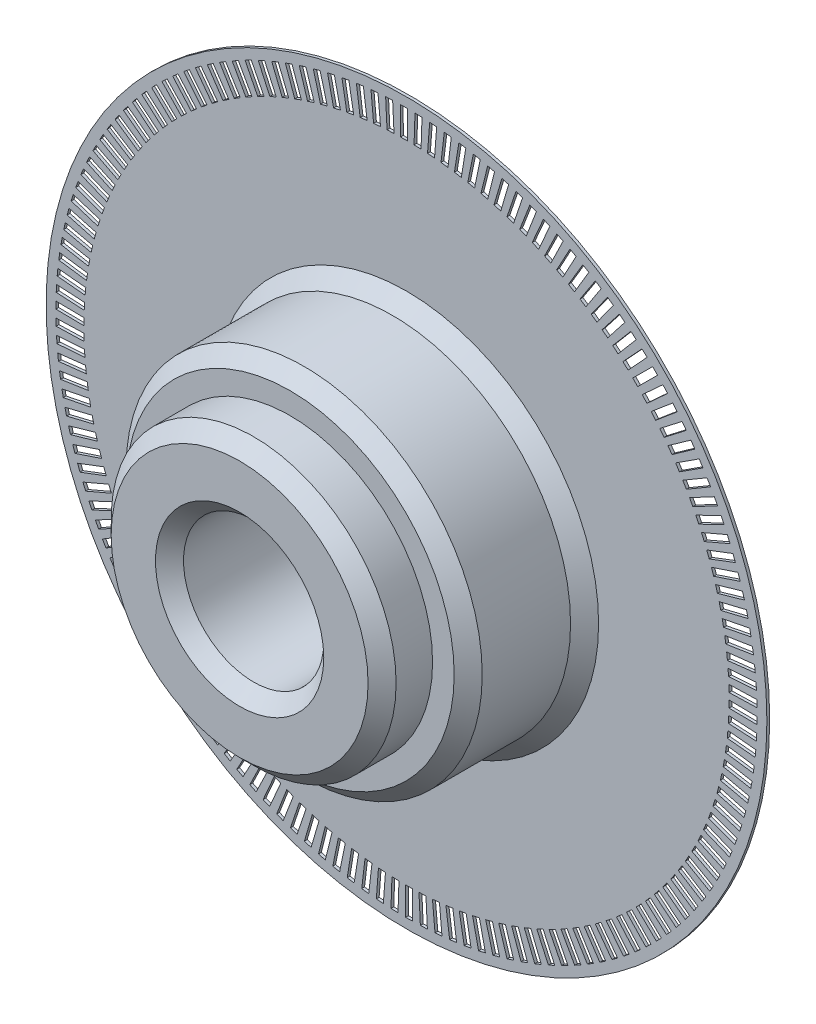
from build123d import *

# Parameters (mm, degrees)
SZKIC1_R                        = 12.85
DODANIE_WYCI_GNI_CIE1_DEPTH     = 0.1
SZKIC2_R                        = 6.35
DODANIE_WYCI_GNI_CIE2_DEPTH     = 4.15
SZKIC3_R                        = 5.08
DODANIE_WYCI_GNI_CIE3_DEPTH     = 1.8
WYTNIJ_WYCI_GNI_CIE1_DEPTH      = 20.15326343
WYTNIJ_WYCI_GNI_CIE1_DEPTH_BACK = 20.15326343
SZKIC5_R                        = 2.5
SFAZOWANIE1_SIZE                = 0.5
WYTNIJ_WYCI_GNI_CIE2_DEPTH      = 20.15326343


with BuildPart() as part:
    # Szkic1 → Dodanie-wyciągnięcie1 (new body)
    with BuildSketch(Plane.XY):
        Circle(SZKIC1_R)
    extrude(amount=DODANIE_WYCI_GNI_CIE1_DEPTH)

    # Szkic2 → Dodanie-wyciągnięcie2 (add)
    with BuildSketch(Plane.XY.offset(0.1)):
        Circle(SZKIC2_R)
    extrude(amount=DODANIE_WYCI_GNI_CIE2_DEPTH)

    # Szkic3 → Dodanie-wyciągnięcie3 (add)
    with BuildSketch(Plane.XY.offset(4.25)):
        Circle(SZKIC3_R)
    extrude(amount=DODANIE_WYCI_GNI_CIE3_DEPTH)

    # Szkic5 → Wytnij-wyciągnięcie1 (cut, two sides: drawn at the far end of the back side and taken through both)
    with BuildSketch(Plane(origin=(0, 0, 0), x_dir=(-1, 0, 0), z_dir=(0, 0, -1)).offset(-WYTNIJ_WYCI_GNI_CIE1_DEPTH_BACK)):
        Circle(SZKIC5_R)
    extrude(amount=WYTNIJ_WYCI_GNI_CIE1_DEPTH + WYTNIJ_WYCI_GNI_CIE1_DEPTH_BACK, mode=Mode.SUBTRACT)

    # Sfazowanie1
    sfazowanie1_edges = [part.edges().sort_by_distance(p)[0] for p in [
        (-5.08, 0, 6.05),
        (2.5, 0, 0),
        (2.5, 0, 6.05),
        (-6.35, 0, 0.1),
        (-6.35, 0, 4.25),
    ]]
    chamfer(sfazowanie1_edges, length=SFAZOWANIE1_SIZE)

    # Szkic7 → Wytnij-wyciągnięcie2 (cut, through all)
    with BuildSketch(Plane(origin=(0, 0, 0), x_dir=(-1, 0, 0), z_dir=(0, 0, -1))):
        Polygon((-4.431248358, -10.614251271), (-4.806721156, -11.541084685), (-4.575012803, -11.634952885), (-4.199540005, -10.70811947), align=None)
        Polygon((-3.747446792, -10.874585113), (-4.083778481, -11.816328706), (-4.319214379, -11.732245784), (-3.98288269, -10.790502191), align=None)
        Polygon((-4.871840111, -10.419379347), (-5.285795311, -11.329676602), (-5.058220997, -11.433165402), (-4.644265798, -10.522868147), align=None)
        Polygon((-5.303885002, -10.206228292), (-5.755596385, -11.098392417), (-5.532555353, -11.211320263), (-5.08084397, -10.319156138), align=None)
        Polygon((-5.726625075, -9.975172044), (-6.215300187, -10.84763788), (-5.997183728, -10.969806658), (-5.508508616, -10.097340822), align=None)
        Polygon((-6.139318702, -9.726615954), (-6.66410024, -10.5778529), (-6.451291004, -10.709048284), (-5.926509466, -9.857811339), align=None)
        Polygon((-6.541241878, -9.460996075), (-7.101209197, -10.289510772), (-6.894080523, -10.429502601), (-6.334113204, -9.600987905), align=None)
        Polygon((-6.931689494, -9.178778395), (-7.52586022, -9.983117345), (-7.324775483, -10.131660027), (-6.730604756, -9.327321076), align=None)
        Polygon((-7.30997657, -8.880458018), (-7.937308327, -9.659210139), (-7.742620297, -9.816043078), (-7.11528854, -9.037290957), align=None)
        Polygon((-7.675439463, -8.566558299), (-8.334831698, -9.318357395), (-8.146881924, -9.483205454), (-7.487489689, -8.731406358), align=None)
        Polygon((-8.027437028, -8.237629927), (-8.717732943, -8.961157086), (-8.536851153, -9.133731065), (-7.846555238, -8.410203906), align=None)
        Polygon((-8.36535174, -7.894249953), (-9.085340321, -8.588235863), (-8.911843843, -8.768233008), (-8.191855263, -8.074247098), align=None)
        Polygon((-8.688590783, -7.537020782), (-9.437008925, -8.200247956), (-9.271202131, -8.387352491), (-8.522783989, -7.724125317), align=None)
        Polygon((-8.996587085, -7.166569115), (-9.772121809, -7.797874027), (-9.61429558, -7.991757708), (-8.838760857, -7.360452796), align=None)
        Polygon((-9.288800316, -6.783544851), (-10.09009107, -7.381819978), (-9.940522288, -7.582142666), (-9.139231534, -6.983867539), align=None)
        Polygon((-9.564717835, -6.388619944), (-10.390358883, -6.952815708), (-10.249309942, -7.15922597), (-9.423668894, -6.595030206), align=None)
        Polygon((-9.823855589, -5.982487226), (-10.672398476, -6.511613836), (-10.540116824, -6.723749558), (-9.691573937, -6.194622948), align=None)
        Polygon((-10.065758962, -5.565859194), (-10.935715056, -6.058988382), (-10.812432759, -6.276477405), (-9.942476665, -5.783348217), align=None)
        Polygon((-10.290003574, -5.139466753), (-11.179846675, -5.595733402), (-11.065780012, -5.818194178), (-10.175936911, -5.361927528), align=None)
        Polygon((-10.496196023, -4.704057941), (-11.404365044, -5.122661605), (-11.299714128, -5.349703861), (-10.391545106, -4.931100196), align=None)
        Polygon((-10.683974577, -4.260396612), (-11.608876282, -4.640602919), (-11.513824705, -4.871828346), (-10.588923, -4.491622039), align=None)
        Polygon((-10.853009809, -3.809261101), (-11.793021606, -4.150403039), (-11.707736122, -4.385405988), (-10.767724325, -4.04426405), align=None)
        Polygon((-11.003005174, -3.351442851), (-11.956477963, -3.652921941), (-11.881108191, -3.891290138), (-10.927635402, -3.589811048), align=None)
        Polygon((-11.13369753, -2.887745032), (-12.098958595, -3.149032377), (-12.033636758, -3.390347643), (-11.068375694, -3.129060298), align=None)
        Polygon((-11.244857596, -2.418981126), (-12.220213542, -2.63961834), (-12.165054238, -2.883457326), (-11.189698293, -2.662820112), align=None)
        Polygon((-11.336290362, -1.945973506), (-12.320030082, -2.125573515), (-12.275130079, -2.371508445), (-11.291390359, -2.191908436), align=None)
        Polygon((-11.407835422, -1.469551987), (-12.398233103, -1.607799712), (-12.363671171, -1.855399133), (-11.37327349, -1.717151407), align=None)
        Polygon((-11.459367262, -0.990552374), (-12.45468541, -1.087205283), (-12.430522183, -1.33603482), (-11.435204035, -1.239381911), align=None)
        Polygon((-11.490795478, -0.509814996), (-12.489287967, -0.564703525), (-12.475565834, -0.814326647), (-11.477073346, -0.759438118), align=None)
        Polygon((-11.502064935, -0.028183229), (-12.501980068, -0.041211086), (-12.498723104, -0.29118987), (-11.49880797, -0.278162012), align=None)
        Polygon((-11.493155861, 0.453497981), (-12.492739449, 0.482353651), (-12.499953367, 0.232457754), (-11.500369778, 0.203602084), align=None)
        Polygon((-11.464083886, 0.934383601), (-12.461582319, 1.005072176), (-12.479254463, 0.755697568), (-11.481756029, 0.685008993), align=None)
        Polygon((-11.414900012, 1.413629995), (-12.40856334, 1.526027463), (-12.436662707, 1.277611632), (-11.442999379, 1.165214163), align=None)
        Polygon((-11.345690525, 1.890396402), (-12.333775524, 2.04430558), (-12.372252819, 1.79728433), (-11.38416782, 1.643375152), align=None)
        Polygon((-11.256576842, 2.363846411), (-12.237350075, 2.55899729), (-12.286137795, 2.313803981), (-11.305364562, 2.118653103), align=None)
        Polygon((-11.147715298, 2.83314943), (-12.119456155, 3.069199648), (-12.17846871, 2.826264434), (-11.206727852, 2.590214215), align=None)
        Polygon((-11.019296873, 3.297482142), (-11.980300592, 3.574017588), (-12.049434453, 3.333766659), (-11.088430735, 3.057231212), align=None)
        Polygon((-10.871546857, 3.75602995), (-11.820127509, 4.072565487), (-11.899261394, 3.835420324), (-10.950680741, 3.518884787), align=None)
        Polygon((-10.704724454, 4.207988405), (-11.639217907, 4.563968721), (-11.728212986, 4.330345358), (-10.793719533, 3.974365042), align=None)
        Polygon((-10.519122326, 4.652564619), (-11.437889162, 5.047365204), (-11.536589308, 4.817673495), (-10.617822473, 4.42287291), align=None)
        Polygon((-10.315066084, 5.088978654), (-11.216494472, 5.521906893), (-11.324726532, 5.296549796), (-10.423298144, 4.863621557), align=None)
        Polygon((-10.09291371, 5.51646489), (-10.97542224, 5.986761281), (-11.092996338, 5.766134149), (-10.210487808, 5.295837758), align=None)
        Polygon((-9.853054937, 5.934273373), (-10.715095387, 6.441112856), (-10.841805258, 6.225602743), (-9.979764808, 5.71876326), align=None)
        Polygon((-9.595910557, 6.341671124), (-10.435970617, 6.88416453), (-10.571593968, 6.674149515), (-9.731533908, 6.131656109), align=None)
        Polygon((-9.321931689, 6.737943428), (-10.138537607, 7.31513904), (-10.28283651, 7.11098756), (-9.466230592, 6.533791949), align=None)
        Polygon((-9.031598985, 7.122395091), (-9.823318158, 7.73328031), (-9.976039463, 7.535350517), (-9.18432029, 6.924465297), align=None)
        Polygon((-8.725421788, 7.494351652), (-9.49086527, 8.137854779), (-9.651741052, 7.946493908), (-8.886297569, 7.302990781), align=None)
        Polygon((-8.403937236, 7.853160573), (-9.14176218, 8.528152685), (-9.310510208, 8.343696449), (-8.572685264, 7.668704337), align=None)
        Polygon((-8.067709322, 8.198192383), (-8.776621333, 8.903489314), (-8.952945566, 8.726261311), (-8.244033555, 8.02096438), align=None)
        Polygon((-7.717327905, 8.528841777), (-8.396083309, 9.263206197), (-8.579674414, 9.093517346), (-7.90091901, 8.359152926), align=None)
        Polygon((-7.353407672, 8.844528685), (-8.000815703, 9.606672269), (-8.191351598, 9.444820261), (-7.543943568, 8.682676677), align=None)
        Polygon((-6.976587063, 9.144699284), (-7.591511946, 9.933284973), (-7.788658369, 9.779553752), (-7.173733486, 8.990968063), align=None)
        Polygon((-6.587527151, 9.428826973), (-7.168890099, 10.24247132), (-7.372301185, 10.097130583), (-6.790938237, 9.283486236), align=None)
        Polygon((-6.186910477, 9.696413296), (-6.733691582, 10.533688892), (-6.943010481, 10.396993615), (-6.396229376, 9.55971802), align=None)
        Polygon((-5.775439859, 9.946988815), (-6.286679882, 10.806426794), (-6.501539376, 10.678616788), (-5.990299354, 9.819178809), align=None)
        Polygon((-5.353837158, 10.180113935), (-5.828639209, 11.060206551), (-6.048662363, 10.941506039), (-5.573860312, 10.061413423), align=None)
        Polygon((-4.922842007, 10.395379677), (-5.360373122, 11.294582948), (-5.58517394, 11.185200169), (-5.147642825, 10.285996898), align=None)
        Polygon((-4.483210519, 10.59240839), (-4.88270312, 11.509144809), (-5.111887225, 11.409271658), (-4.712394623, 10.49253524), align=None)
        Polygon((-4.035713955, 10.770854419), (-4.396467197, 11.703515718), (-4.629632522, 11.613327408), (-4.26887928, 10.680666109), align=None)
        Polygon((-3.581137379, 10.93040471), (-3.902518377, 11.877354685), (-4.13925587, 11.797009435), (-3.817874872, 10.850059461), align=None)
        Polygon((-3.12027827, 11.070779357), (-3.401723213, 12.030356735), (-3.641617557, 11.959995499), (-3.360172614, 11.000418121), align=None)
        Polygon((-2.653945133, 11.191732095), (-2.894960271, 12.162253451), (-3.13759061, 12.101999667), (-2.896575472, 11.13147831), align=None)
        Polygon((-2.182956074, 11.293050732), (-2.383118585, 12.272813443), (-2.628059262, 12.222772815), (-2.427896752, 11.243010104), align=None)
        Polygon((-1.708137369, 11.37455752), (-1.867096099, 12.361842749), (-2.113917406, 12.322103066), (-1.954958676, 11.334817838), align=None)
        Polygon((-1.23032201, 11.43610947), (-1.347798092, 12.429185182), (-1.59606702, 12.399816162), (-1.478590938, 11.406740449), align=None)
        Polygon((-0.750348249, 11.477598597), (-0.826135589, 12.474722601), (-1.07541659, 12.455775766), (-0.99962925, 11.458651762), align=None)
        Polygon((-0.269058121, 11.498952117), (-0.303023764, 12.498375118), (-0.552879514, 12.489883707), (-0.518913871, 11.490460706), align=None)
        Polygon((0.212704026, 11.500132567), (0.220619668, 12.500101237), (-0.0293725, 12.502080148), (-0.037288142, 11.502111477), align=None)
        Polygon((0.694093017, 11.481137876), (0.743876058, 12.479897932), (0.494186044, 12.492343692), (0.444403003, 11.493583637), align=None)
        Polygon((1.174264334, 11.442001369), (1.265827437, 12.437800645), (1.016877618, 12.460691421), (0.925314515, 11.464892145), align=None)
        Polygon((1.652375592, 11.382791703), (1.785558124, 12.373883229), (1.537785243, 12.407178862), (1.40460271, 11.416087336), align=None)
        Polygon((2.127588021, 11.303612753), (2.302156336, 12.288257818), (2.055995069, 12.331899896), (1.881426755, 11.347254831), align=None)
        Polygon((2.599067939, 11.204603425), (2.814715783, 12.181074626), (2.570597982, 12.234986587), (2.354950138, 11.258515386), align=None)
        Polygon((3.065988208, 11.085937415), (3.322337262, 12.052521691), (3.080691193, 12.116608954), (2.824342139, 11.150024678), align=None)
        Polygon((3.527529692, 10.947822904), (3.824130232, 11.902824537), (3.585379824, 11.976974672), (3.288779283, 11.021973039), align=None)
        Polygon((3.98288269, 10.790502191), (4.319214379, 11.732245784), (4.083778481, 11.816328706), (3.747446792, 10.874585113), align=None)
        Polygon((4.431248358, 10.614251271), (4.806721156, 11.541084685), (4.575012803, 11.634952885), (4.199540005, 10.70811947), align=None)
        Polygon((4.871840111, 10.419379347), (5.285795311, 11.329676602), (5.058220997, 11.433165402), (4.644265798, 10.522868147), align=None)
        Polygon((5.303885002, 10.206228292), (5.755596385, 11.098392417), (5.532555353, 11.211320263), (5.08084397, 10.319156138), align=None)
        Polygon((5.726625075, 9.975172044), (6.215300187, 10.84763788), (5.997183728, 10.969806658), (5.508508616, 10.097340822), align=None)
        Polygon((6.139318702, 9.726615954), (6.66410024, 10.5778529), (6.451291004, 10.709048284), (5.926509466, 9.857811339), align=None)
        Polygon((6.541241878, 9.460996075), (7.101209197, 10.289510772), (6.894080523, 10.429502601), (6.334113204, 9.600987905), align=None)
        Polygon((6.931689494, 9.178778395), (7.52586022, 9.983117345), (7.324775483, 10.131660027), (6.730604756, 9.327321076), align=None)
        Polygon((7.30997657, 8.880458018), (7.937308327, 9.659210139), (7.742620297, 9.816043078), (7.11528854, 9.037290957), align=None)
        Polygon((7.675439463, 8.566558299), (8.334831698, 9.318357395), (8.146881924, 9.483205454), (7.487489689, 8.731406358), align=None)
        Polygon((8.027437028, 8.237629927), (8.717732943, 8.961157086), (8.536851153, 9.133731065), (7.846555238, 8.410203906), align=None)
        Polygon((8.36535174, 7.894249953), (9.085340321, 8.588235863), (8.911843843, 8.768233008), (8.191855263, 8.074247098), align=None)
        Polygon((8.688590783, 7.537020782), (9.437008925, 8.200247956), (9.271202131, 8.387352491), (8.522783989, 7.724125317), align=None)
        Polygon((8.996587085, 7.166569115), (9.772121809, 7.797874027), (9.61429558, 7.991757708), (8.838760857, 7.360452796), align=None)
        Polygon((9.288800316, 6.783544851), (10.09009107, 7.381819978), (9.940522288, 7.582142666), (9.139231534, 6.983867539), align=None)
        Polygon((9.564717835, 6.388619944), (10.390358883, 6.952815708), (10.249309942, 7.15922597), (9.423668894, 6.595030206), align=None)
        Polygon((9.823855589, 5.982487226), (10.672398476, 6.511613836), (10.540116824, 6.723749558), (9.691573937, 6.194622948), align=None)
        Polygon((10.065758962, 5.565859194), (10.935715056, 6.058988382), (10.812432759, 6.276477405), (9.942476665, 5.783348217), align=None)
        Polygon((10.290003574, 5.139466753), (11.179846675, 5.595733402), (11.065780012, 5.818194178), (10.175936911, 5.361927528), align=None)
        Polygon((10.496196023, 4.704057941), (11.404365044, 5.122661605), (11.299714128, 5.349703861), (10.391545106, 4.931100196), align=None)
        Polygon((10.683974577, 4.260396612), (11.608876282, 4.640602919), (11.513824705, 4.871828346), (10.588923, 4.491622039), align=None)
        Polygon((10.853009809, 3.809261101), (11.793021606, 4.150403039), (11.707736122, 4.385405988), (10.767724325, 4.04426405), align=None)
        Polygon((11.003005174, 3.351442851), (11.956477963, 3.652921941), (11.881108191, 3.891290138), (10.927635402, 3.589811048), align=None)
        Polygon((11.13369753, 2.887745032), (12.098958595, 3.149032377), (12.033636758, 3.390347643), (11.068375694, 3.129060298), align=None)
        Polygon((11.244857596, 2.418981126), (12.220213542, 2.63961834), (12.165054238, 2.883457326), (11.189698293, 2.662820112), align=None)
        Polygon((11.336290362, 1.945973506), (12.320030082, 2.125573515), (12.275130079, 2.371508445), (11.291390359, 2.191908436), align=None)
        Polygon((11.407835422, 1.469551987), (12.398233103, 1.607799712), (12.363671171, 1.855399133), (11.37327349, 1.717151407), align=None)
        Polygon((11.459367262, 0.990552374), (12.45468541, 1.087205283), (12.430522183, 1.33603482), (11.435204035, 1.239381911), align=None)
        Polygon((11.490795478, 0.509814996), (12.489287967, 0.564703525), (12.475565834, 0.814326647), (11.477073346, 0.759438118), align=None)
        Polygon((11.502064935, 0.028183229), (12.501980068, 0.041211086), (12.498723104, 0.29118987), (11.49880797, 0.278162012), align=None)
        Polygon((11.493155861, -0.453497981), (12.492739449, -0.482353651), (12.499953367, -0.232457754), (11.500369778, -0.203602084), align=None)
        Polygon((11.464083886, -0.934383601), (12.461582319, -1.005072176), (12.479254463, -0.755697568), (11.481756029, -0.685008993), align=None)
        Polygon((11.414900012, -1.413629995), (12.40856334, -1.526027463), (12.436662707, -1.277611632), (11.442999379, -1.165214163), align=None)
        Polygon((11.345690525, -1.890396402), (12.333775524, -2.04430558), (12.372252819, -1.79728433), (11.38416782, -1.643375152), align=None)
        Polygon((11.256576842, -2.363846411), (12.237350075, -2.55899729), (12.286137795, -2.313803981), (11.305364562, -2.118653103), align=None)
        Polygon((11.147715298, -2.83314943), (12.119456155, -3.069199648), (12.17846871, -2.826264434), (11.206727852, -2.590214215), align=None)
        Polygon((11.019296873, -3.297482142), (11.980300592, -3.574017588), (12.049434453, -3.333766659), (11.088430735, -3.057231212), align=None)
        Polygon((10.871546857, -3.75602995), (11.820127509, -4.072565487), (11.899261394, -3.835420324), (10.950680741, -3.518884787), align=None)
        Polygon((10.704724454, -4.207988405), (11.639217907, -4.563968721), (11.728212986, -4.330345358), (10.793719533, -3.974365042), align=None)
        Polygon((10.519122326, -4.652564619), (11.437889162, -5.047365204), (11.536589308, -4.817673495), (10.617822473, -4.42287291), align=None)
        Polygon((10.315066084, -5.088978654), (11.216494472, -5.521906893), (11.324726532, -5.296549796), (10.423298144, -4.863621557), align=None)
        Polygon((10.09291371, -5.51646489), (10.97542224, -5.986761281), (11.092996338, -5.766134149), (10.210487808, -5.295837758), align=None)
        Polygon((9.853054937, -5.934273373), (10.715095387, -6.441112856), (10.841805258, -6.225602743), (9.979764808, -5.71876326), align=None)
        Polygon((9.595910557, -6.341671124), (10.435970617, -6.88416453), (10.571593968, -6.674149515), (9.731533908, -6.131656109), align=None)
        Polygon((9.321931689, -6.737943428), (10.138537607, -7.31513904), (10.28283651, -7.11098756), (9.466230592, -6.533791949), align=None)
        Polygon((9.031598985, -7.122395091), (9.823318158, -7.73328031), (9.976039463, -7.535350517), (9.18432029, -6.924465297), align=None)
        Polygon((8.725421788, -7.494351652), (9.49086527, -8.137854779), (9.651741052, -7.946493908), (8.886297569, -7.302990781), align=None)
        Polygon((8.403937236, -7.853160573), (9.14176218, -8.528152685), (9.310510208, -8.343696449), (8.572685264, -7.668704337), align=None)
        Polygon((8.067709322, -8.198192383), (8.776621333, -8.903489314), (8.952945566, -8.726261311), (8.244033555, -8.02096438), align=None)
        Polygon((7.717327905, -8.528841777), (8.396083309, -9.263206197), (8.579674414, -9.093517346), (7.90091901, -8.359152926), align=None)
        Polygon((7.353407672, -8.844528685), (8.000815703, -9.606672269), (8.191351598, -9.444820261), (7.543943568, -8.682676677), align=None)
        Polygon((6.976587063, -9.144699284), (7.591511946, -9.933284973), (7.788658369, -9.779553752), (7.173733486, -8.990968063), align=None)
        Polygon((6.587527151, -9.428826973), (7.168890099, -10.24247132), (7.372301185, -10.097130583), (6.790938237, -9.283486236), align=None)
        Polygon((6.186910477, -9.696413296), (6.733691582, -10.533688892), (6.943010481, -10.396993615), (6.396229376, -9.55971802), align=None)
        Polygon((5.775439859, -9.946988815), (6.286679882, -10.806426794), (6.501539376, -10.678616788), (5.990299354, -9.819178809), align=None)
        Polygon((5.353837158, -10.180113935), (5.828639209, -11.060206551), (6.048662363, -10.941506039), (5.573860312, -10.061413423), align=None)
        Polygon((4.922842007, -10.395379677), (5.360373122, -11.294582948), (5.58517394, -11.185200169), (5.147642825, -10.285996898), align=None)
        Polygon((4.483210519, -10.59240839), (4.88270312, -11.509144809), (5.111887225, -11.409271658), (4.712394623, -10.49253524), align=None)
        Polygon((4.035713955, -10.770854419), (4.396467197, -11.703515718), (4.629632522, -11.613327408), (4.26887928, -10.680666109), align=None)
        Polygon((3.581137379, -10.93040471), (3.902518377, -11.877354685), (4.13925587, -11.797009435), (3.817874872, -10.850059461), align=None)
        Polygon((3.12027827, -11.070779357), (3.401723213, -12.030356735), (3.641617557, -11.959995499), (3.360172614, -11.000418121), align=None)
        Polygon((2.653945133, -11.191732095), (2.894960271, -12.162253451), (3.13759061, -12.101999667), (2.896575472, -11.13147831), align=None)
        Polygon((2.182956074, -11.293050732), (2.383118585, -12.272813443), (2.628059262, -12.222772815), (2.427896752, -11.243010104), align=None)
        Polygon((1.708137369, -11.37455752), (1.867096099, -12.361842749), (2.113917406, -12.322103066), (1.954958676, -11.334817838), align=None)
        Polygon((1.23032201, -11.43610947), (1.347798092, -12.429185182), (1.59606702, -12.399816162), (1.478590938, -11.406740449), align=None)
        Polygon((0.750348249, -11.477598597), (0.826135589, -12.474722601), (1.07541659, -12.455775766), (0.99962925, -11.458651762), align=None)
        Polygon((0.269058121, -11.498952117), (0.303023764, -12.498375118), (0.552879514, -12.489883707), (0.518913871, -11.490460706), align=None)
        Polygon((-0.212704026, -11.500132567), (-0.220619668, -12.500101237), (0.0293725, -12.502080148), (0.037288142, -11.502111477), align=None)
        Polygon((-0.694093017, -11.481137876), (-0.743876058, -12.479897932), (-0.494186044, -12.492343692), (-0.444403003, -11.493583637), align=None)
        Polygon((-1.174264334, -11.442001369), (-1.265827437, -12.437800645), (-1.016877618, -12.460691421), (-0.925314515, -11.464892145), align=None)
        Polygon((-1.652375592, -11.382791703), (-1.785558124, -12.373883229), (-1.537785243, -12.407178862), (-1.40460271, -11.416087336), align=None)
        Polygon((-2.127588021, -11.303612753), (-2.302156336, -12.288257818), (-2.055995069, -12.331899896), (-1.881426755, -11.347254831), align=None)
        Polygon((-2.599067939, -11.204603425), (-2.814715783, -12.181074626), (-2.570597982, -12.234986587), (-2.354950138, -11.258515386), align=None)
        Polygon((-3.065988208, -11.085937415), (-3.322337262, -12.052521691), (-3.080691193, -12.116608954), (-2.824342139, -11.150024678), align=None)
        Polygon((-3.527529692, -10.947822904), (-3.824130232, -11.902824537), (-3.585379824, -11.976974672), (-3.288779283, -11.021973039), align=None)
    extrude(amount=-WYTNIJ_WYCI_GNI_CIE2_DEPTH, mode=Mode.SUBTRACT)


solid = part.part
